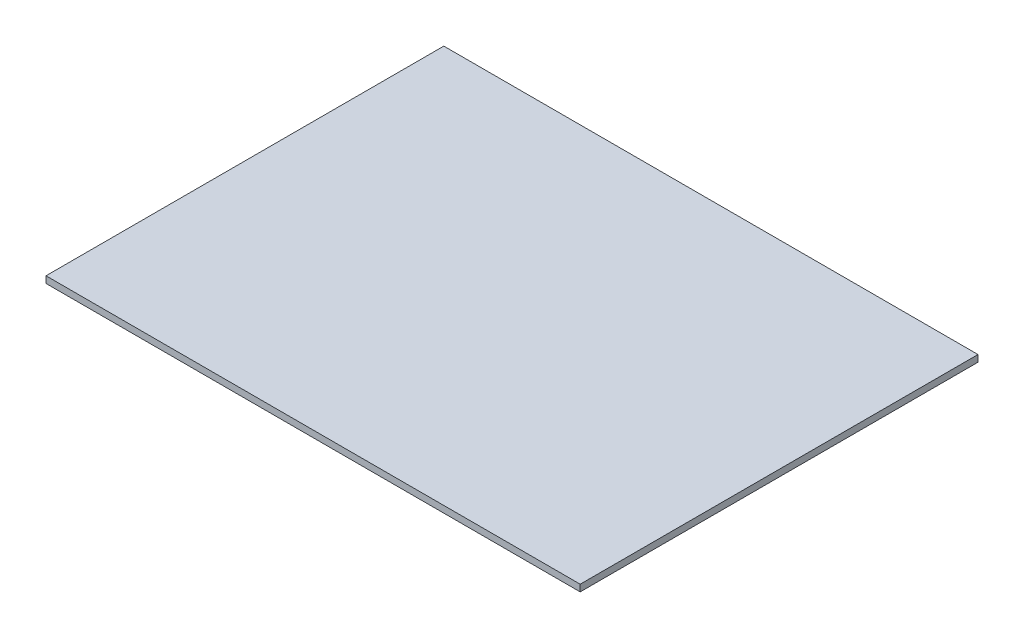
from build123d import *

# Parameters (mm, degrees)
SKETCH1_W           = 399.5
SKETCH1_H           = 297.5
BOSS_EXTRUDE1_DEPTH = 5


with BuildPart() as part:
    # Sketch1 → Boss-Extrude1 (new body)
    with BuildSketch(Plane(origin=(0, 0, 0), x_dir=(1, 0, 0), z_dir=(0, 1, 0))):
        with Locations((199.75, 148.75)):
            Rectangle(SKETCH1_W, SKETCH1_H)
    extrude(amount=BOSS_EXTRUDE1_DEPTH)


solid = part.part
